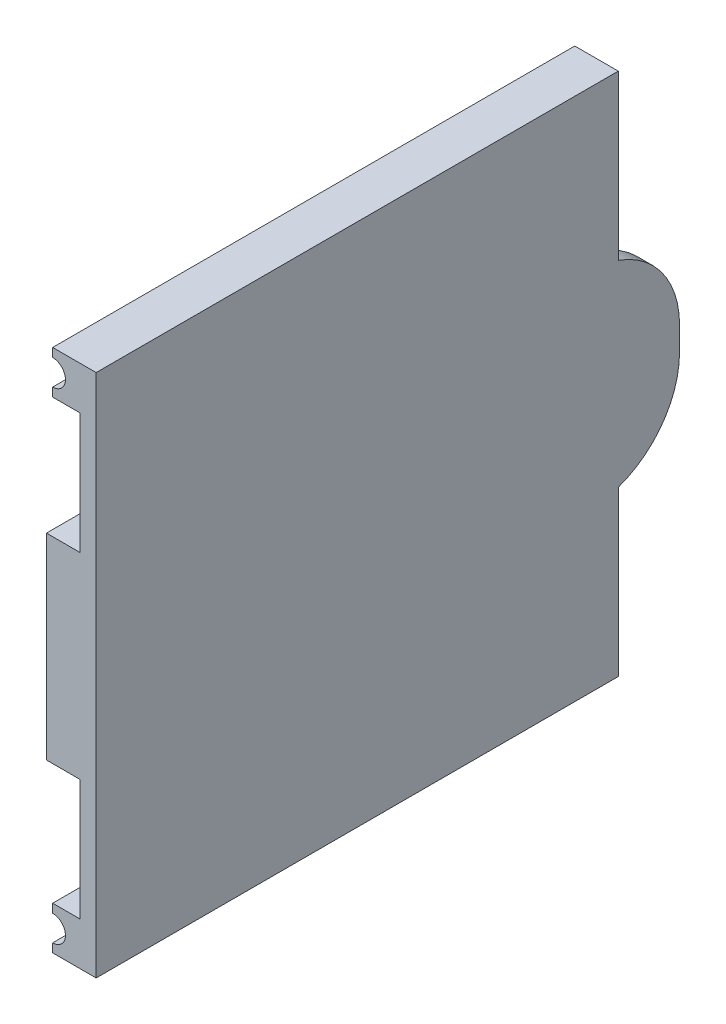
from build123d import *
from build123d.topology import SkipClean

# Parameters (mm, degrees)
CROQUIS1_W                = 1.742923262
CROQUIS1_H                = 57.241679132
SALIENTE_EXTRUIR1_DEPTH   = 55
CROQUIS1_W_2              = 1.671507147
CROQUIS1_H_2              = 21.456626134
SALIENTE_EXTRUIR1_2_DEPTH = 55
CROQUIS2_W                = 3.684913484
CROQUIS2_H                = 21.456626134
SALIENTE_EXTRUIR2_DEPTH   = 2
CROQUIS3_W                = 6.689505602
CROQUIS3_H                = 21.456626134
SALIENTE_EXTRUIR3_DEPTH   = 1.742923
REDONDEO1_R               = 10
SALIENTE_EXTRUIR4_DEPTH   = 57


with BuildPart() as part:
    # Croquis1 → Saliente-Extruir1 (new body)
    with BuildSketch(Plane.XY):
        with Locations((-2.447737274, 25.2)):
            Rectangle(CROQUIS1_W, CROQUIS1_H)
    extrude(amount=-SALIENTE_EXTRUIR1_DEPTH)



with BuildPart() as body_2:
    # Croquis1 → Saliente-Extruir1 2 (new body)
    with BuildSketch(Plane.XY):
        with Locations((-6.168358816, 25.2)):
            Rectangle(CROQUIS1_W_2, CROQUIS1_H_2)
    extrude(amount=-SALIENTE_EXTRUIR1_2_DEPTH)


with BuildPart() as part_1:
    add(part.part)

    add(body_2.part)  # Saliente-Extruir2 merges body 2
    # Croquis2 → Saliente-Extruir2 (add)
    with BuildSketch(Plane.XY):
        with Locations((-5.161655647, 25.2)):
            Rectangle(CROQUIS2_W, CROQUIS2_H)
        Polygon((-3.319198905, 53.820839566), (-3.319198905, 35.928313067), (-3.319198905, 14.471686933), (-3.319198905, -3.420839566), (-1.576275643, -3.420839566), (-1.576275643, 14.471686933), (-1.576275643, 35.928313067), (-1.576275643, 53.820839566), align=None)
    extrude(amount=SALIENTE_EXTRUIR2_DEPTH)

    # Croquis3 → Saliente-Extruir3 (add, through all)
    with SkipClean():  # the faces are left unmerged after this step: merging them gives an invalid solid
        with BuildSketch(Plane.ZY.offset(3.319198905)):
            with Locations((-58.344752801, 25.2)):
                Rectangle(CROQUIS3_W, CROQUIS3_H)
        extrude(amount=-SALIENTE_EXTRUIR3_DEPTH)

    # Redondeo1
    # the kernel refuses this fillet: 10 mm, written as the material it takes off along each edge
    with BuildSketch(Plane(origin=(-26.909534167, 14.471686933, -61.689505602), x_dir=(0, 0, 1), z_dir=(1, 0, 0))) as redondeo1_piece_1:
        with BuildLine():
            CenterArc((10, -9.436134105), REDONDEO1_R, 109.332484587, 70.667515413)
            Line((0, -9.436134105), (-0.2, -9.436134105))
            Line((-0.2, -9.436134105), (-0.2, 0))
            Line((-0.2, 0), (0, 0.2))
            ThreePointArc((0, 0.2), (3.344752801, 0.2), (6.623295714, 0.188722682))
            Line((6.623295714, 0.188722682), (6.689505602, 0))
        make_face()
    extrude(amount=48.923593524, mode=Mode.SUBTRACT)
    with BuildSketch(Plane(origin=(-26.909534167, 35.928313067, -61.689505602), x_dir=(0, -1, 0), z_dir=(1, 0, 0))) as redondeo1_piece_2:
        with BuildLine():
            CenterArc((9.436134105, -10), REDONDEO1_R, 90, 70.667515413)
            Line((0, -6.689505602), (-0.188722682, -6.623295714))
            ThreePointArc((-0.188722682, -6.623295714), (-0.2, -3.344752801), (-0.2, 0))
            Line((-0.2, 0), (0, 0.2))
            Line((0, 0.2), (9.436134105, 0.2))
            Line((9.436134105, 0.2), (9.436134105, 0))
        make_face()
    extrude(amount=48.923593524, mode=Mode.SUBTRACT)

    # Croquis6 → Cortar-Revolución4 (revolve, cut)
    with SkipClean():  # the faces are left unmerged after this step: merging them gives an invalid solid
        with BuildSketch(Plane.ZY.offset(4.319198905)):
            with BuildLine():
                Line((-58.022003986, 30.9962324), (-58.022003986, 19.291046994))
                add(Edge.make_bspline(
                    [(-58.022003986, 30.9962324), (-60.287786898, 30.9962324), (-60.287786898, 25.143639697), (-60.287786898, 19.291046994), (-58.022003986, 19.291046994)],
                    knots=[3.141592654, 3.141592654, 3.141592654, 4.71238898, 4.71238898, 6.283185307, 6.283185307, 6.283185307], degree=2, weights=[1, 0.707106781, 1, 0.707106781, 1]))
            make_face()
        revolve(axis=Axis((-4.319198905, 19.291046994, -58.022003986), (0, 1, 0)), mode=Mode.SUBTRACT)

    # Croquis7 → Saliente-Extruir4 (add)
    with SkipClean():  # the faces are left unmerged after this step: merging them gives an invalid solid
        with BuildSketch(Plane(origin=(0, 0, -55), x_dir=(-1, 0, 0), z_dir=(0, 0, -1))):
            with BuildLine():
                Line((6.325110646, 50.074635433), (6.325110646, 49.12294906))
                Line((6.325110646, 49.12294906), (3.319198905, 49.12294906))
                Line((3.319198905, 49.12294906), (3.319198905, 53.820839566))
                Line((3.319198905, 53.820839566), (6.325110646, 53.820839566))
                Line((6.325110646, 53.820839566), (6.325110646, 52.869153193))
                ThreePointArc((6.325110646, 52.869153193), (4.927851766, 51.471894313), (6.325110646, 50.074635433))
            make_face()
            with BuildLine():
                Line((6.325110646, -3.420839566), (6.325110646, -2.469153193))
                ThreePointArc((6.325110646, -2.469153193), (4.927851766, -1.071894313), (6.325110646, 0.325364567))
                Line((6.325110646, 0.325364567), (6.325110646, 1.27705094))
                Line((6.325110646, 1.27705094), (3.319198905, 1.27705094))
                Line((3.319198905, 1.27705094), (3.319198905, -3.420839566))
                Line((3.319198905, -3.420839566), (6.325110646, -3.420839566))
            make_face()
        extrude(amount=-SALIENTE_EXTRUIR4_DEPTH)


solid = part_1.part
